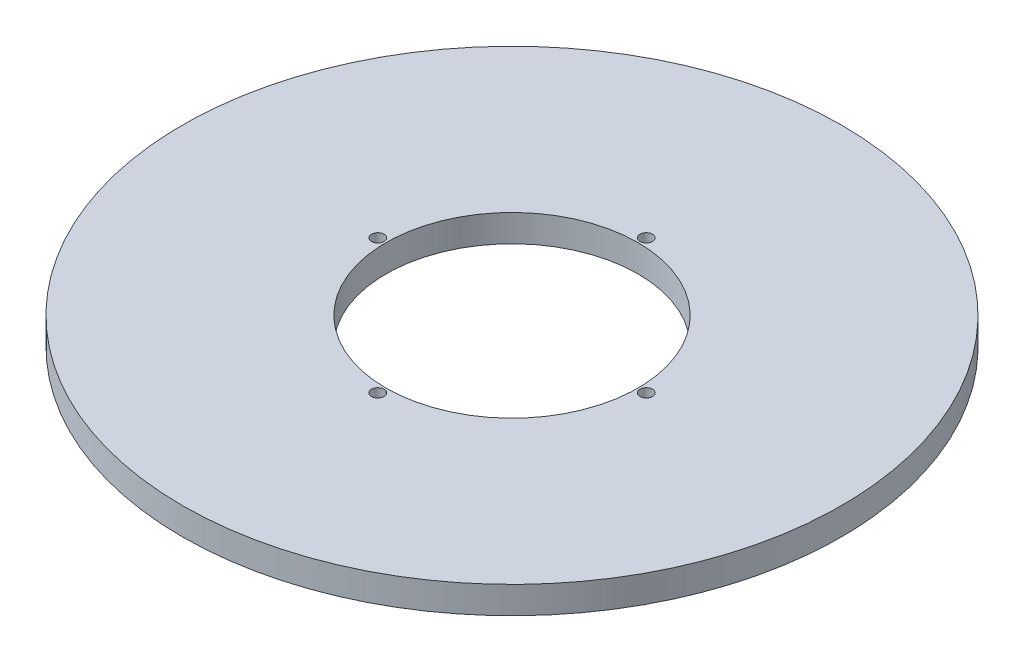
from build123d import *

# Parameters (mm, degrees)
SKETCH1_R           = 85
BOSS_EXTRUDE1_DEPTH = 7
SKETCH2_R           = 32.5
CUT_EXTRUDE1_DEPTH  = 121.411793442
SKETCH3_R           = 1.625700543
CUT_EXTRUDE2_DEPTH  = 6.872683155
CIRPATTERN1_COUNT   = 4


with BuildPart() as part:
    # Sketch1 → Boss-Extrude1 (new body)
    with BuildSketch(Plane(origin=(0, 0, 0), x_dir=(1, 0, 0), z_dir=(0, 1, 0))):
        Circle(SKETCH1_R)
    extrude(amount=BOSS_EXTRUDE1_DEPTH)

    # Sketch2 → Cut-Extrude1 (cut, through all)
    with BuildSketch(Plane(origin=(0, 0, 0), x_dir=(1, 0, 0), z_dir=(0, 1, 0))):
        Circle(SKETCH2_R)
    extrude(amount=CUT_EXTRUDE1_DEPTH, mode=Mode.SUBTRACT)

    # Sketch3 → Cut-Extrude2 (cut)
    with BuildSketch(Plane(origin=(0, 7, 0), x_dir=(1, 0, 0), z_dir=(0, 1, 0))):
        with Locations((-34.619906271, 0)):
            Circle(SKETCH3_R)
    cut_extrude2 = extrude(amount=-CUT_EXTRUDE2_DEPTH, mode=Mode.SUBTRACT)

    # CirPattern1: Cut-Extrude2 ×4 about axis
    cirpattern1_axis = Axis((0, 0, 0), (0, 1, 0))
    for i in range(1, CIRPATTERN1_COUNT):
        add(cut_extrude2.rotate(cirpattern1_axis, i * 360 / CIRPATTERN1_COUNT), mode=Mode.SUBTRACT)


solid = part.part
